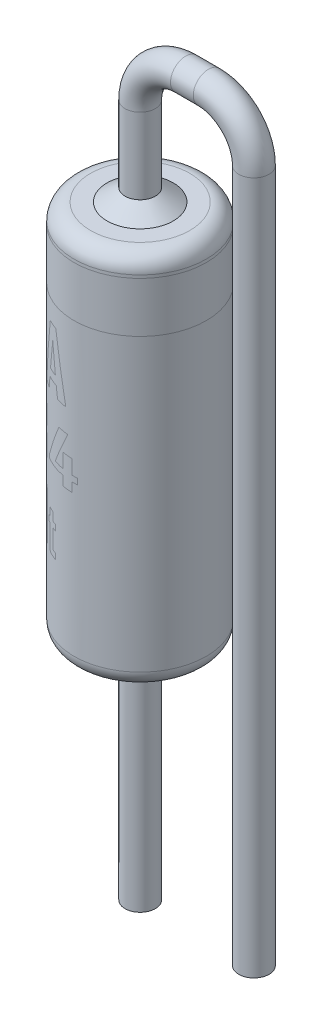
from build123d import *

# Parameters (mm, degrees)
SKETCH6_R = 0.254


with BuildPart() as part:
    # Sketch10 → BODY_main (revolve)
    with BuildSketch(Plane.XY):
        with BuildLine():
            Line((-0.830625, 7.525), (-0.55375, 7.525))
            Line((-0.55375, 7.525), (-0.55375, 1.21))
            Line((-0.55375, 1.21), (-0.830625, 1.21))
            ThreePointArc((-0.830625, 1.21), (-1.02640519, 1.29109481), (-1.1075, 1.486875))
            Line((-1.1075, 1.486875), (-1.1075, 7.248125))
            ThreePointArc((-1.1075, 7.248125), (-1.02640519, 7.44390519), (-0.830625, 7.525))
        make_face()
    revolve(axis=Axis((0, 1, 0), (0, 1, 0)))


with BuildPart() as body_2:
    # Sketch11 → BODY_to_PIN (revolve)
    with BuildSketch(Plane.XY):
        Polygon((0, 1.21), (0, 1), (-0.254, 1), (-0.55375, 1.21), align=None)
        Polygon((-0.55375, 7.525), (0, 7.525), (0, 7.735), (-0.254, 7.735), align=None)
    revolve(axis=Axis((0, 1, 0), (0, 1, 0)))


with BuildPart() as body_3:
    # PINS: sweep along a path in Sketch7
    with BuildLine(Plane.XY) as pins_path:
        Line((0, -2.6), (0, 9.005))
        ThreePointArc((0, 9.005), (0.223184633, 9.543815367), (0.762, 9.767))
        Line((0.762, 9.767), (1.143, 9.767))
        ThreePointArc((1.143, 9.767), (1.681815367, 9.543815367), (1.905, 9.005))
        Line((1.905, 9.005), (1.905, -2.6))
    # Sketch6 → PINS (sweep)
    with BuildSketch(Plane(origin=(1, 1, 0), x_dir=(0, 0, -1), z_dir=(0, 1, 0))):
        with Locations((0, 1)):
            Circle(SKETCH6_R)
    sweep(path=pins_path.line)


solid = Compound([part.part, body_2.part, body_3.part])
